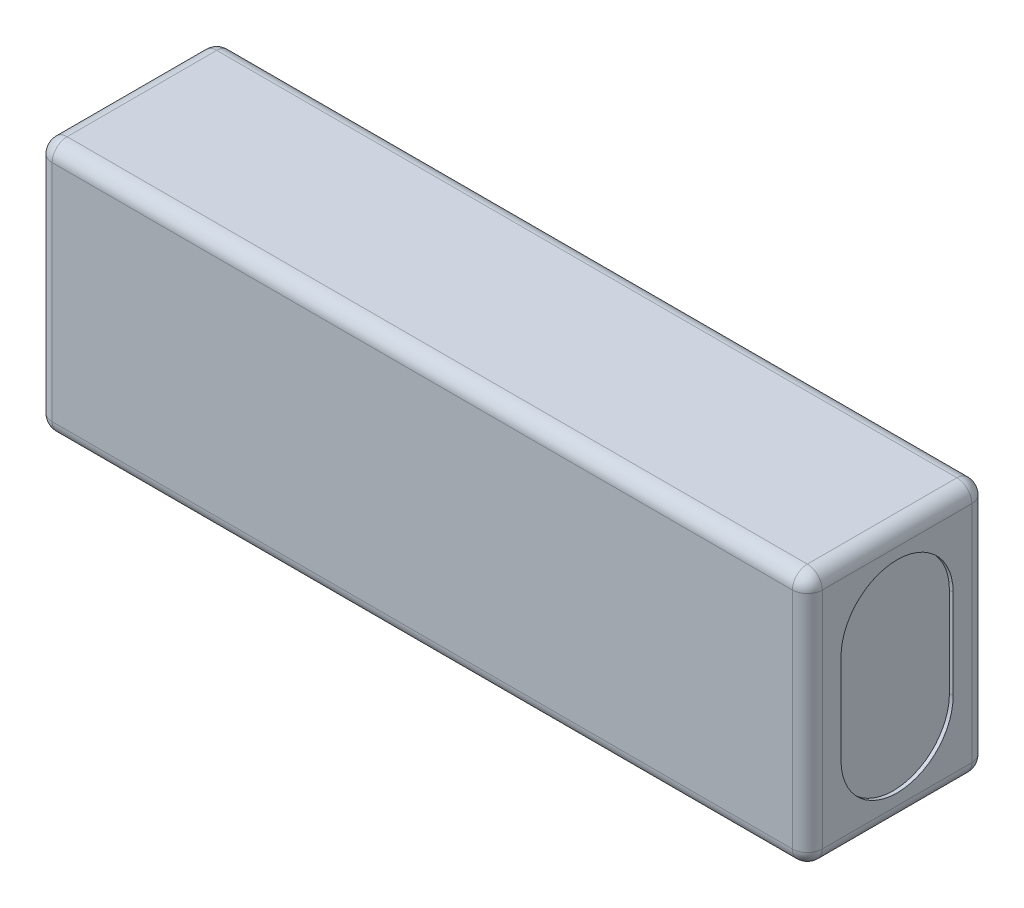
from build123d import *

# Parameters (mm, degrees)
ESBO_O1_W                = 103
ESBO_O1_H                = 34
RESSALTO_EXTRUS_O1_DEPTH = 24
CORTE_EXTRUS_O1_DEPTH    = 0.5
FILETE1_R                = 2


with BuildPart() as part:
    # Esboço1 → Ressalto-extrusão1 (new body)
    with BuildSketch(Plane.XY):
        Rectangle(ESBO_O1_W, ESBO_O1_H)
    extrude(amount=RESSALTO_EXTRUS_O1_DEPTH)

    # Esboço2 → Corte-extrusão1 (cut)
    with BuildSketch(Plane(origin=(51.5, 0, 0), x_dir=(0, 0, -1), z_dir=(1, 0, 0))):
        with BuildLine():
            Line((-4.5, 6), (-4.5, -6))
            ThreePointArc((-4.5, -6), (-12, -13.5), (-19.5, -6))
            Line((-19.5, -6), (-19.5, 6))
            ThreePointArc((-19.5, 6), (-12, 13.5), (-4.5, 6))
        make_face()
    corte_extrus_o1 = extrude(amount=-CORTE_EXTRUS_O1_DEPTH, mode=Mode.SUBTRACT)

    # Espelhar1: Corte-extrusão1 across plane
    add(corte_extrus_o1.mirror(Plane(origin=(0, 0, 0), x_dir=(0, 0, 1), z_dir=(1, 0, 0))), mode=Mode.SUBTRACT)

    # Filete1
    filete1_edges = [part.edges().sort_by_distance(p)[0] for p in [
        (-51.5, -17, 12),
        (51.5, -17, 12),
        (-51.5, 0, 0),
        (0, -17, 0),
        (51.5, 0, 0),
        (51.5, 17, 12),
        (-51.5, 17, 12),
        (0, 17, 0),
        (0, -17, 24),
        (-51.5, 0, 24),
        (0, 17, 24),
        (51.5, 0, 24),
    ]]
    fillet(filete1_edges, radius=FILETE1_R)


solid = part.part
